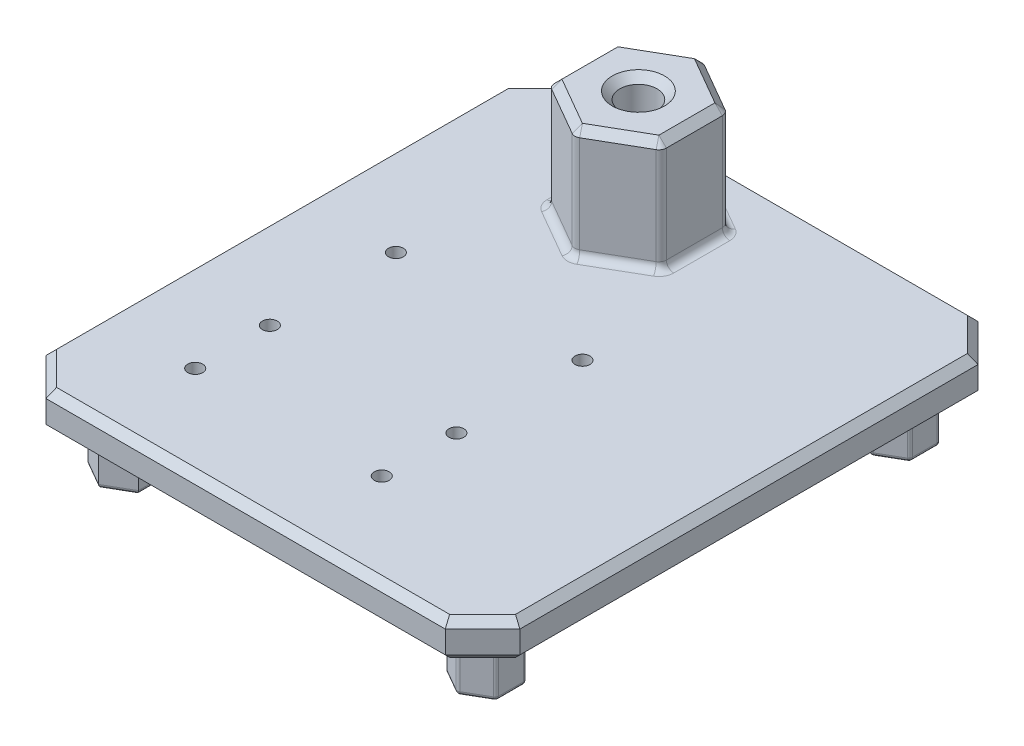
from build123d import *

# Parameters (mm, degrees)
SKETCH2_R                 = 5
BOSS_EXTRUDE1_DEPTH       = 30
BOSS_EXTRUDE2_DEPTH       = 10
F_4_0MM_DOWEL_HOLE1_D     = 4
F_4_0MM_DOWEL_HOLE1_DEPTH = 10
F_4_0MM_DOWEL_HOLE1_TIP   = 1.201721238
FILLET1_R                 = 2
CHAMFER1_SIZE             = 2
CHAMFER2_SIZE             = 2
BOSS_EXTRUDE3_DEPTH       = 15
CHAMFER3_SIZE             = 0.5
CHAMFER4_SIZE             = 2
F_4_0MM_DOWEL_HOLE2_D     = 4
F_4_0MM_DOWEL_HOLE2_DEPTH = 15
F_4_0MM_DOWEL_HOLE2_TIP   = 1.201721238
FILLET2_R                 = 1


with BuildPart() as part:
    # Sketch2 → Boss-Extrude1 (new body)
    with BuildSketch(Plane(origin=(0, 0, 0), x_dir=(1, 0, 0), z_dir=(0, 1, 0))):
        Polygon((0, -17.320508076), (15, -8.660254038), (15, 8.660254038), (0, 17.320508076), (-15, 8.660254038), (-15, -8.660254038), align=None)
        with Locations(Location((0, 0, 0), (0, 0, 270))):
            Circle(SKETCH2_R, mode=Mode.SUBTRACT)
    extrude(amount=BOSS_EXTRUDE1_DEPTH)

    # Sketch4 → Boss-Extrude2 (add)
    with BuildSketch(Plane(origin=(0, 0, 0), x_dir=(1, 0, 0), z_dir=(0, 1, 0))):
        Polygon((-40, 24.002729649), (-50, 14.002729649), (-50, -108.797415894), (-40, -118.797415894), (67.021799919, -118.797415894), (77.021799919, -108.797415894), (77.021799919, 14.002729649), (67.021799919, 24.002729649), align=None)
    extrude(amount=-BOSS_EXTRUDE2_DEPTH)

    # Ø4.0mm Dowel Hole1
    with Locations(Plane(origin=(0, 0, 0), x_dir=(1, 0, 0), z_dir=(0, 1, 0))):
        with Locations((-25, -40), (25, -40), (-25, -73.797415894), (-25, -93.797415894), (25, -73.797415894), (25, -93.797415894)):
            Hole(F_4_0MM_DOWEL_HOLE1_D / 2, depth=F_4_0MM_DOWEL_HOLE1_DEPTH)
            with Locations((0, 0, -(F_4_0MM_DOWEL_HOLE1_DEPTH + F_4_0MM_DOWEL_HOLE1_TIP / 2))):  # 118° drill point
                Cone(0, F_4_0MM_DOWEL_HOLE1_D / 2, F_4_0MM_DOWEL_HOLE1_TIP, mode=Mode.SUBTRACT)

    # Fillet1
    fillet1_edges = [part.edges().sort_by_distance(p)[0] for p in [
        (-15, 15, 8.660254038),
        (-15, 15, -8.660254038),
        (0, 15, -17.320508076),
        (15, 15, -8.660254038),
        (15, 15, 8.660254038),
        (0, 15, 17.320508076),
        (-15, 0, 0),
        (-7.5, 0, -12.990381057),
        (7.5, 0, -12.990381057),
        (15, 0, 0),
        (7.5, 0, 12.990381057),
        (-7.5, 0, 12.990381057),
    ]]
    fillet(fillet1_edges, radius=FILLET1_R)

    # Chamfer1
    chamfer1_edges = [part.edges().sort_by_distance(p)[0] for p in [
        (15, 30, 0),
        (7.5, 30, 12.990381057),
        (14.732050808, 30, 8.505553499),
        (0, 30, 17.011106999),
        (-14.732050808, 30, 8.505553499),
        (-14.732050808, 30, -8.505553499),
        (0, 30, -17.011106999),
        (14.732050808, 30, -8.505553499),
        (-7.5, 30, -12.990381057),
        (-15, 30, 0),
        (7.5, 30, -12.990381057),
        (-7.5, 30, 12.990381057),
    ]]
    chamfer(chamfer1_edges, length=CHAMFER1_SIZE - 0.0001)  # a hair under: the kernel refuses the full size

    # Chamfer2
    chamfer2_edges = [part.edges().sort_by_distance(p)[0] for p in [
        (0, 30, -5),
    ]]
    chamfer(chamfer2_edges, length=CHAMFER2_SIZE)

    # Sketch7 → Boss-Extrude3 (add)
    with BuildSketch(Plane.XZ.offset(10)):
        with BuildLine():
            Line((-28.25, -12.322493697), (-28.25, -5.682965601))
            ThreePointArc((-28.25, -5.682965601), (-28.383974596, -5.182965601), (-28.75, -4.816940197))
            Line((-28.75, -4.816940197), (-34.5, -1.49717615))
            ThreePointArc((-34.5, -1.49717615), (-35, -1.363201553), (-35.5, -1.49717615))
            Line((-35.5, -1.49717615), (-41.25, -4.816940197))
            ThreePointArc((-41.25, -4.816940197), (-41.616025404, -5.182965601), (-41.75, -5.682965601))
            Line((-41.75, -5.682965601), (-41.75, -12.322493697))
            ThreePointArc((-41.75, -12.322493697), (-41.616025404, -12.822493697), (-41.25, -13.188519101))
            Line((-41.25, -13.188519101), (-35.5, -16.508283149))
            ThreePointArc((-35.5, -16.508283149), (-35, -16.642257745), (-34.5, -16.508283149))
            Line((-34.5, -16.508283149), (-28.75, -13.188519101))
            ThreePointArc((-28.75, -13.188519101), (-28.383974596, -12.822493697), (-28.25, -12.322493697))
        make_face()
        with BuildLine():
            Line((67.75, -12.322493697), (67.75, -5.682965601))
            ThreePointArc((67.75, -5.682965601), (67.616025404, -5.182965601), (67.25, -4.816940197))
            Line((67.25, -4.816940197), (61.5, -1.49717615))
            ThreePointArc((61.5, -1.49717615), (61, -1.363201553), (60.5, -1.49717615))
            Line((60.5, -1.49717615), (54.75, -4.816940197))
            ThreePointArc((54.75, -4.816940197), (54.383974596, -5.182965601), (54.25, -5.682965601))
            Line((54.25, -5.682965601), (54.25, -12.322493697))
            ThreePointArc((54.25, -12.322493697), (54.383974596, -12.822493697), (54.75, -13.188519101))
            Line((54.75, -13.188519101), (60.5, -16.508283149))
            ThreePointArc((60.5, -16.508283149), (61, -16.642257745), (61.5, -16.508283149))
            Line((61.5, -16.508283149), (67.25, -13.188519101))
            ThreePointArc((67.25, -13.188519101), (67.616025404, -12.822493697), (67.75, -12.322493697))
        make_face()
        with BuildLine():
            Line((67.75, 98.557506303), (67.75, 105.197034399))
            ThreePointArc((67.75, 105.197034399), (67.616025404, 105.697034399), (67.25, 106.063059803))
            Line((67.25, 106.063059803), (61.5, 109.38282385))
            ThreePointArc((61.5, 109.38282385), (61, 109.516798447), (60.5, 109.38282385))
            Line((60.5, 109.38282385), (54.75, 106.063059803))
            ThreePointArc((54.75, 106.063059803), (54.383974596, 105.697034399), (54.25, 105.197034399))
            Line((54.25, 105.197034399), (54.25, 98.557506303))
            ThreePointArc((54.25, 98.557506303), (54.383974596, 98.057506303), (54.75, 97.691480899))
            Line((54.75, 97.691480899), (60.5, 94.371716851))
            ThreePointArc((60.5, 94.371716851), (61, 94.237742255), (61.5, 94.371716851))
            Line((61.5, 94.371716851), (67.25, 97.691480899))
            ThreePointArc((67.25, 97.691480899), (67.616025404, 98.057506303), (67.75, 98.557506303))
        make_face()
        Polygon((-35, 94.083041717), (-28.25, 97.980156034), (-28.25, 105.774384668), (-35, 109.671498985), (-41.75, 105.774384668), (-41.75, 97.980156034), align=None)
    extrude(amount=BOSS_EXTRUDE3_DEPTH)

    # Chamfer3
    chamfer3_edges = [part.edges().sort_by_distance(p)[0] for p in [
        (67.616025404, -10, 98.057506303),
        (67.75, -10, 101.877270351),
        (67.616025404, -10, 105.697034399),
        (64.375, -10, 107.722941826),
        (61, -10, 109.516798447),
        (57.625, -10, 107.722941826),
        (54.383974596, -10, 105.697034399),
        (54.25, -10, 101.877270351),
        (54.383974596, -10, 98.057506303),
        (57.625, -10, 96.031598875),
        (61, -10, 94.237742255),
        (64.375, -10, 96.031598875),
        (67.616025404, -10, -5.182965601),
        (64.375, -10, -3.157058174),
        (61, -10, -1.363201553),
        (57.625, -10, -3.157058174),
        (54.383974596, -10, -5.182965601),
        (54.25, -10, -9.002729649),
        (54.383974596, -10, -12.822493697),
        (57.625, -10, -14.848401125),
        (61, -10, -16.642257745),
        (64.375, -10, -14.848401125),
        (67.616025404, -10, -12.822493697),
        (67.75, -10, -9.002729649),
        (-28.383974596, -10, -5.182965601),
        (-31.625, -10, -3.157058174),
        (-35, -10, -1.363201553),
        (-38.375, -10, -3.157058174),
        (-41.616025404, -10, -5.182965601),
        (-41.75, -10, -9.002729649),
        (-41.616025404, -10, -12.822493697),
        (-38.375, -10, -14.848401125),
        (-35, -10, -16.642257745),
        (-31.625, -10, -14.848401125),
        (-28.383974596, -10, -12.822493697),
        (-28.25, -10, -9.002729649),
        (-38.375, -10, 96.031598875),
        (-31.625, -10, 96.031598875),
        (-28.25, -10, 101.877270351),
        (-31.625, -10, 107.722941826),
        (-38.375, -10, 107.722941826),
        (-41.75, -10, 101.877270351),
    ]]
    chamfer(chamfer3_edges, length=CHAMFER3_SIZE)

    # Chamfer4
    chamfer4_edges = [part.edges().sort_by_distance(p)[0] for p in [
        (-45, -10, -19.002729649),
        (13.510899959, 0, -24.002729649),
        (72.021799919, 0, -19.002729649),
        (77.021799919, 0, 47.397343123),
        (72.021799919, -10, 113.797415894),
        (13.510899959, -10, 118.797415894),
        (-45, -10, 113.797415894),
        (-50, -10, 47.397343123),
        (13.510899959, -10, -24.002729649),
        (72.021799919, -10, -19.002729649),
        (77.021799919, -10, 47.397343123),
        (-45, 0, -19.002729649),
        (-50, 0, 47.397343123),
        (-45, 0, 113.797415894),
        (13.510899959, 0, 118.797415894),
        (72.021799919, 0, 113.797415894),
    ]]
    chamfer(chamfer4_edges, length=CHAMFER4_SIZE)

    # Ø4.0mm Dowel Hole2
    with Locations(Plane.XZ.offset(25)):
        with Locations((-35, 101.877270351), (61, 101.877270351), (61, -9.002729649), (-35, -9.002729649)):
            Hole(F_4_0MM_DOWEL_HOLE2_D / 2, depth=F_4_0MM_DOWEL_HOLE2_DEPTH)
            with Locations((0, 0, -(F_4_0MM_DOWEL_HOLE2_DEPTH + F_4_0MM_DOWEL_HOLE2_TIP / 2))):  # 118° drill point
                Cone(0, F_4_0MM_DOWEL_HOLE2_D / 2, F_4_0MM_DOWEL_HOLE2_TIP, mode=Mode.SUBTRACT)

    # Fillet2
    fillet2_edges = [part.edges().sort_by_distance(p)[0] for p in [
        (67.616025404, -25, 98.057506303),
        (67.75, -25, 101.877270351),
        (67.616025404, -25, 105.697034399),
        (64.375, -25, 107.722941826),
        (61, -25, 109.516798447),
        (57.625, -25, 107.722941826),
        (54.383974596, -25, 105.697034399),
        (54.25, -25, 101.877270351),
        (54.383974596, -25, 98.057506303),
        (57.625, -25, 96.031598875),
        (61, -25, 94.237742255),
        (64.375, -25, 96.031598875),
        (67.616025404, -25, -5.182965601),
        (64.375, -25, -3.157058174),
        (61, -25, -1.363201553),
        (57.625, -25, -3.157058174),
        (54.383974596, -25, -5.182965601),
        (54.25, -25, -9.002729649),
        (54.383974596, -25, -12.822493697),
        (57.625, -25, -14.848401125),
        (61, -25, -16.642257745),
        (64.375, -25, -14.848401125),
        (67.616025404, -25, -12.822493697),
        (67.75, -25, -9.002729649),
        (-28.383974596, -25, -5.182965601),
        (-31.625, -25, -3.157058174),
        (-35, -25, -1.363201553),
        (-38.375, -25, -3.157058174),
        (-41.616025404, -25, -5.182965601),
        (-41.75, -25, -9.002729649),
        (-41.616025404, -25, -12.822493697),
        (-38.375, -25, -14.848401125),
        (-35, -25, -16.642257745),
        (-31.625, -25, -14.848401125),
        (-28.383974596, -25, -12.822493697),
        (-28.25, -25, -9.002729649),
        (-38.375, -25, 96.031598875),
        (-31.625, -25, 96.031598875),
        (-28.25, -25, 101.877270351),
        (-31.625, -25, 107.722941826),
        (-38.375, -25, 107.722941826),
        (-41.75, -25, 101.877270351),
    ]]
    fillet(fillet2_edges, radius=FILLET2_R)


solid = part.part
